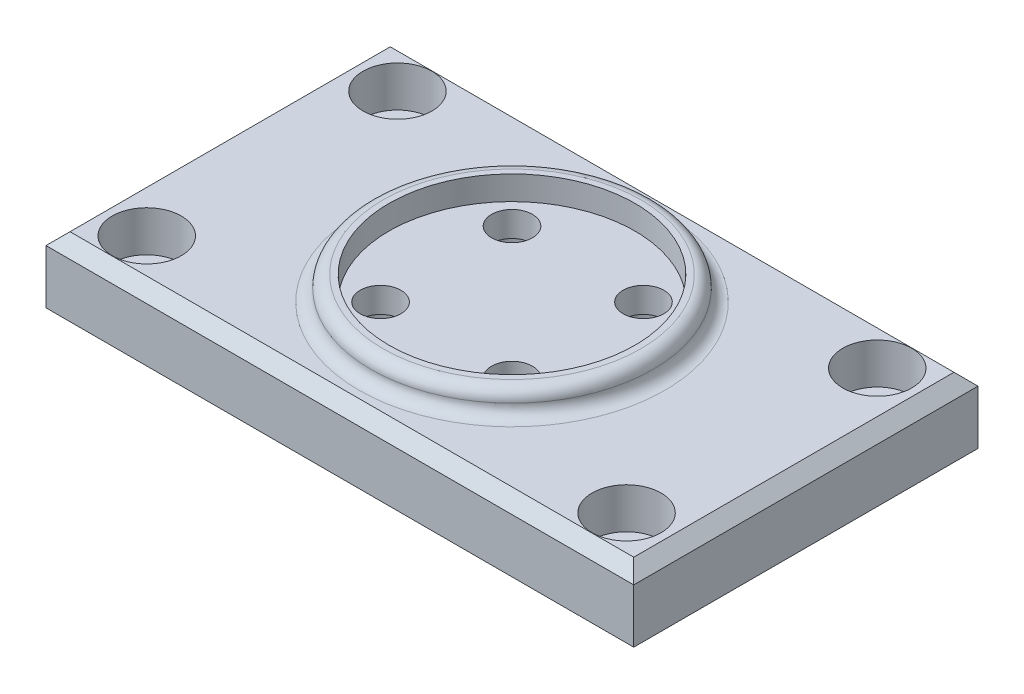
from build123d import *

# Parameters (mm, degrees)
SKETCH1_W                      = 49
SKETCH1_H                      = 28.7
BOSS_EXTRUDE1_DEPTH            = 5.5
CBORE_FOR_M3_SHCS1_D           = 3.4
CBORE_FOR_M3_SHCS1_CBORE_D     = 5.75
CBORE_FOR_M3_SHCS1_CBORE_DEPTH = 3.4
CBORE_FOR_M3_SHCS2_D           = 3.4
CBORE_FOR_M3_SHCS2_CBORE_D     = 5.75
CBORE_FOR_M3_SHCS2_CBORE_DEPTH = 3.4
SKETCH9_R                      = 11.75
SKETCH9_R_2                    = 10.25
BOSS_EXTRUDE2_DEPTH            = 2
FILLET1_R                      = 1
CHAMFER1_SIZE                  = 1


with BuildPart() as part:
    # Sketch1 → Boss-Extrude1 (new body)
    with BuildSketch(Plane(origin=(0, 0, 0), x_dir=(1, 0, 0), z_dir=(0, 1, 0))):
        Rectangle(SKETCH1_W, SKETCH1_H)
    extrude(amount=BOSS_EXTRUDE1_DEPTH)

    # CBORE for M3 SHCS1 (through all)
    with Locations(Plane(origin=(0, 5.5, 0), x_dir=(1, 0, 0), z_dir=(0, 1, 0))):
        with Locations((-20, 10.45), (20, 10.45), (20, -10.45), (-20, -10.45)):
            CounterBoreHole(CBORE_FOR_M3_SHCS1_D / 2, CBORE_FOR_M3_SHCS1_CBORE_D / 2, CBORE_FOR_M3_SHCS1_CBORE_DEPTH)

    # CBORE for M3 SHCS2 (through all)
    with Locations(Plane(origin=(0, 0, 0), x_dir=(-1, 0, 0), z_dir=(0, -1, 0))):
        with Locations((-5.480077554, -5.480077554), (5.480077554, -5.480077554), (5.480077554, 5.480077554), (-5.480077554, 5.480077554)):
            CounterBoreHole(CBORE_FOR_M3_SHCS2_D / 2, CBORE_FOR_M3_SHCS2_CBORE_D / 2, CBORE_FOR_M3_SHCS2_CBORE_DEPTH)

    # Sketch9 → Boss-Extrude2 (add)
    with BuildSketch(Plane(origin=(0, 5.5, 0), x_dir=(1, 0, 0), z_dir=(0, 1, 0))):
        with Locations(Location((0, 0, 0), (0, 0, 270))):
            Circle(SKETCH9_R)
        with Locations(Location((0, 0, 0), (0, 0, 270))):
            Circle(SKETCH9_R_2, mode=Mode.SUBTRACT)
    extrude(amount=BOSS_EXTRUDE2_DEPTH)

    # Fillet1
    fillet1_edges = [part.edges().sort_by_distance(p)[0] for p in [
        (0, 5.5, -11.75),
        (0, 7.5, -11.75),
    ]]
    fillet(fillet1_edges, radius=FILLET1_R - 0.0001)  # a hair under: the kernel refuses the full size

    # Chamfer1
    chamfer1_edges = [part.edges().sort_by_distance(p)[0] for p in [
        (24.5, 5.5, 0),
        (0, 5.5, -14.35),
        (-24.5, 5.5, 0),
        (0, 5.5, 14.35),
    ]]
    chamfer(chamfer1_edges, length=CHAMFER1_SIZE)


solid = part.part
